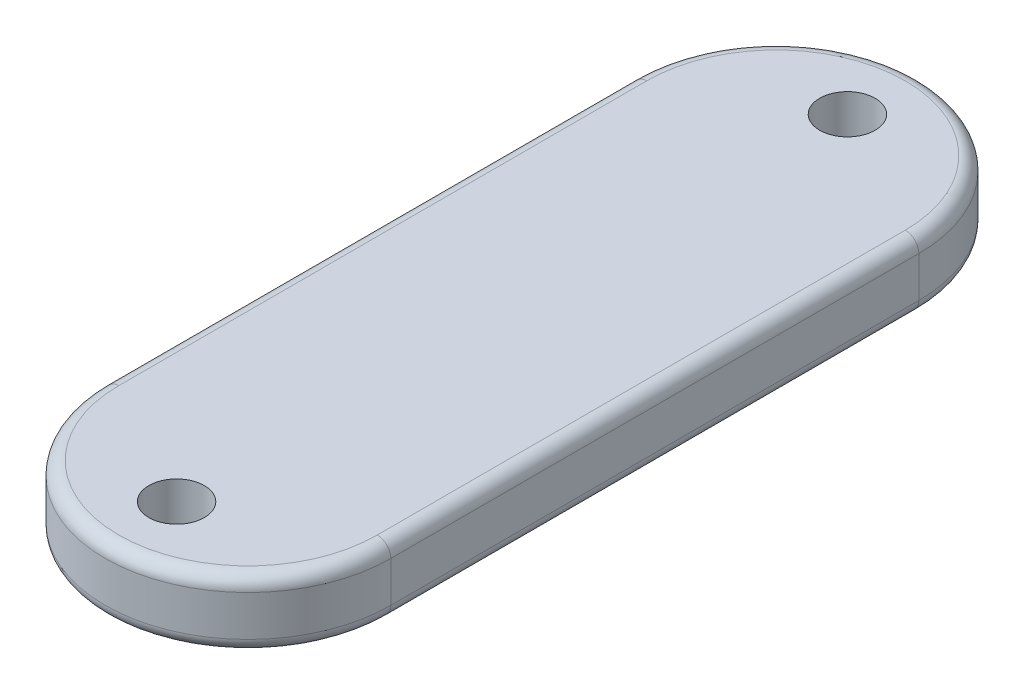
from build123d import *

# Parameters (mm, degrees)
BOSS_EXTRU_1_DEPTH      = 20
CONG_1_R                = 0.5
CONG_2_R                = 1
BOSS_EXTRU_2_DEPTH      = 5
ENL_V_MAT_EXTRU_1_DEPTH = 35.78012648597392
ESQUISSE6_R             = 2.0500000000000007
ESQUISSE6_R_2           = 2.05
BOSS_EXTRU_3_DEPTH      = 5
CONG_4_R                = 1


with BuildPart() as part:
    # Esquisse1 → Boss.-Extru.1 (new body)
    with BuildSketch(Plane.XY):
        Polygon((-1.176e-14, 10.103135382441117), (-2.578e-14, 4.840000000000001), (3.5, 4.840000000000001), (5.71, 6.983135382441116), (5.71, 8.483135382441116), (2.95, 8.483135382441116), (2.95, 10.103135382441117), align=None)
        Polygon((-3.5, 4.840000000000001), (-2.576e-14, 4.840000000000001), (-1.176e-14, 10.103135382441117), (-2.95, 10.103135382441117), (-2.95, 8.483135382441116), (-5.71, 8.483135382441116), (-5.71, 6.983135382441116), align=None)
    extrude(amount=-BOSS_EXTRU_1_DEPTH)

    # Congé1
    cong_1_edges = [part.edges().sort_by_distance(p)[0] for p in [
        (5.71, 7.733135382441116, 0),
        (4.605, 5.911567691220558, 0),
        (0, 4.840000000000001, 0),
        (-4.605, 5.911567691220558, 0),
        (-5.71, 7.733135382441116, 0),
        (-5.71, 7.733135382441116, -20),
        (-4.605, 5.911567691220558, -20),
        (0, 4.840000000000001, -20),
        (4.605, 5.911567691220558, -20),
        (5.71, 7.733135382441116, -20),
    ]]
    fillet(cong_1_edges, radius=CONG_1_R)

    # Congé2
    # the kernel refuses this fillet: 1 mm, written as the material it takes off along each edge
    with BuildSketch(Plane(origin=(4.71, 7.4063748668930085, -20), x_dir=(1, 0, 0), z_dir=(0, 1, 0))) as cong_2_piece_1:
        with BuildLine():
            CenterArc((0.5, -0.5), 0.5, 0, 90)
            Line((1, -0.5), (1, 0))
            Line((1, 0), (0.5, 0))
        make_face()
    revolve(axis=Axis((4.71, 7.4063748668930085, -20), (0, 0, -1)), revolution_arc=45.87999999999987, mode=Mode.SUBTRACT)
    with BuildSketch(Plane(origin=(-4.710000000000001, 7.40637486689301, -20), x_dir=(-0.6961634275566162, -0.717883334625219, 0), z_dir=(0.717883334625219, -0.6961634275566162, 0))) as cong_2_piece_2:
        with BuildLine():
            CenterArc((0.5, -0.5), 0.5, 0, 90)
            Line((1, -0.5), (1, 0))
            Line((1, 0), (0.5, 0))
        make_face()
    revolve(axis=Axis((-4.710000000000001, 7.40637486689301, -20), (0, 0, -1)), revolution_arc=45.87999999999987, mode=Mode.SUBTRACT)
    with BuildSketch(Plane(origin=(4.71, 7.4063748668930085, 0), x_dir=(0.6961634275566162, -0.717883334625219, 0), z_dir=(-0.717883334625219, -0.6961634275566162, 0))) as cong_2_piece_3:
        with BuildLine():
            CenterArc((0.5, -0.5), 0.5, 0, 90)
            Line((1, -0.5), (1, 0))
            Line((1, 0), (0.5, 0))
        make_face()
    revolve(axis=Axis((4.71, 7.4063748668930085, 0), (0, 0, 1)), revolution_arc=45.87999999999987, mode=Mode.SUBTRACT)
    with BuildSketch(Plane(origin=(-4.710000000000001, 7.40637486689301, 0), x_dir=(-1, 0, 0), z_dir=(0, 1, 0))) as cong_2_piece_4:
        with BuildLine():
            CenterArc((0.5, -0.5), 0.5, 0, 90)
            Line((1, -0.5), (1, 0))
            Line((1, 0), (0.5, 0))
        make_face()
    revolve(axis=Axis((-4.710000000000001, 7.40637486689301, 0), (0, 0, 1)), revolution_arc=45.87999999999987, mode=Mode.SUBTRACT)
    with BuildSketch(Plane(origin=(-5.71, 6.983135382441116, 1.1e-16), x_dir=(0.717883334625219, -0.6961634275566161, 0), z_dir=(0, 0, -1))) as cong_2_piece_5:
        with BuildLine():
            CenterArc((CONG_2_R * 0.423239484452, -CONG_2_R), CONG_2_R, 90.00000000000003, 45.879999999999825)
            Line((-CONG_2_R * 0.294643850173, -CONG_2_R * 0.303836572443), (0, 0))
            Line((0, 0), (CONG_2_R * 0.423239484452, 0))
        make_face()
    extrude(amount=20, mode=Mode.SUBTRACT)
    with BuildSketch(Plane(origin=(5.71, 6.983135382441116, 1.1e-16), x_dir=(-0.7178833346252179, -0.6961634275566172, 0), z_dir=(0, 0, -1))) as cong_2_piece_6:
        with BuildLine():
            CenterArc((CONG_2_R * 0.423239484452, CONG_2_R), CONG_2_R, 224.12000000000015, 45.87999999999994)
            Line((-CONG_2_R * 0.294643850173, CONG_2_R * 0.303836572443), (0, 0))
            Line((0, 0), (CONG_2_R * 0.423239484452, 2e-17))
        make_face()
    extrude(amount=20, mode=Mode.SUBTRACT)

    # Esquisse3 → Boss.-Extru.2 (add)
    with BuildSketch(Plane(origin=(0, 10.103135382441117, 0), x_dir=(1, 0, 0), z_dir=(0, 1, 0))):
        Polygon((-10.550000000000004, 29.5), (10.549999999999994, 29.5), (10.55, -9.500000000000002), (-10.55, -9.500000000000002), align=None)
    extrude(amount=BOSS_EXTRU_2_DEPTH)

    # Esquisse5 → Enlèv. mat.-Extru.1 (cut, through all)
    with BuildSketch(Plane.XY):
        with BuildLine():
            Line((-5.209999999999999, 8.483135382441116), (-5.71, 8.483135382441116))
            Line((-5.71, 8.483135382441116), (-5.71, 7.4063748668930085))
            ThreePointArc((-5.71, 7.4063748668930085), (-5.630913521335368, 7.01660790289825), (-5.406163427556616, 6.68849153226779))
            Line((-5.406163427556616, 6.68849153226779), (-3.5, 4.840000000000001))
            Line((-3.5, 4.840000000000001), (3.5, 4.840000000000001))
            Line((3.5, 4.840000000000001), (5.406163427556617, 6.68849153226779))
            ThreePointArc((5.406163427556617, 6.68849153226779), (5.630913521335369, 7.01660790289825), (5.71, 7.406374866893009))
            Line((5.71, 7.406374866893009), (5.71, 8.483135382441116))
            Line((5.71, 8.483135382441116), (5.209999999999999, 8.483135382441116))
            Line((5.209999999999999, 8.483135382441116), (2.95, 8.483135382441116))
            Line((2.95, 8.483135382441116), (-2.95, 8.483135382441116))
            Line((-2.95, 8.483135382441116), (-5.209999999999999, 8.483135382441116))
        make_face()
    extrude(amount=-ENL_V_MAT_EXTRU_1_DEPTH, mode=Mode.SUBTRACT)

    # Esquisse6 → Boss.-Extru.3 (add)
    # profile 1 of 2: a face of its own
    with BuildSketch(Plane(origin=(0, 15.103135382441117, 0), x_dir=(1, 0, 0), z_dir=(0, 1, 0))):
        with BuildLine():
            ThreePointArc((-10.550000000000004, 29.5), (-4.56e-15, 40.05), (10.549999999999994, 29.5))
            Line((10.549999999999994, 29.5), (-10.550000000000004, 29.5))
        make_face()
        with Locations(Location((-5.53e-15, 34.775, 0), (0, 0, 270))):
            Circle(ESQUISSE6_R, mode=Mode.SUBTRACT)
    # profile 2 of 2: a face of its own
    with BuildSketch(Plane(origin=(0, 15.103135382441117, 0), x_dir=(1, 0, 0), z_dir=(0, 1, 0))):
        with BuildLine():
            ThreePointArc((-10.55, -9.500000000000002), (-1.94e-15, -20.050000000000004), (10.55, -9.500000000000002))
            Line((10.55, -9.500000000000002), (-10.55, -9.500000000000002))
        make_face()
        with Locations(Location((-9.7e-16, -14.775000000000002, 0), (0, 0, 270))):
            Circle(ESQUISSE6_R_2, mode=Mode.SUBTRACT)
    extrude(amount=-BOSS_EXTRU_3_DEPTH)

    # Congé4
    cong_4_edges = [part.edges().sort_by_distance(p)[0] for p in [
        (10.549999999999997, 10.103135382441117, -10),
        (-10.550000000000002, 10.103135382441117, -9.999999999999998),
        (10.549999999999997, 15.103135382441117, -10),
        (-10.550000000000002, 15.103135382441117, -9.999999999999998),
        (-8.32e-15, 15.103135382441117, -40.05),
        (-8.32e-15, 10.103135382441117, -40.05),
        (3.15e-15, 10.103135382441117, 20.050000000000004),
        (3.15e-15, 15.103135382441117, 20.050000000000004),
    ]]
    fillet(cong_4_edges, radius=CONG_4_R)


solid = part.part
